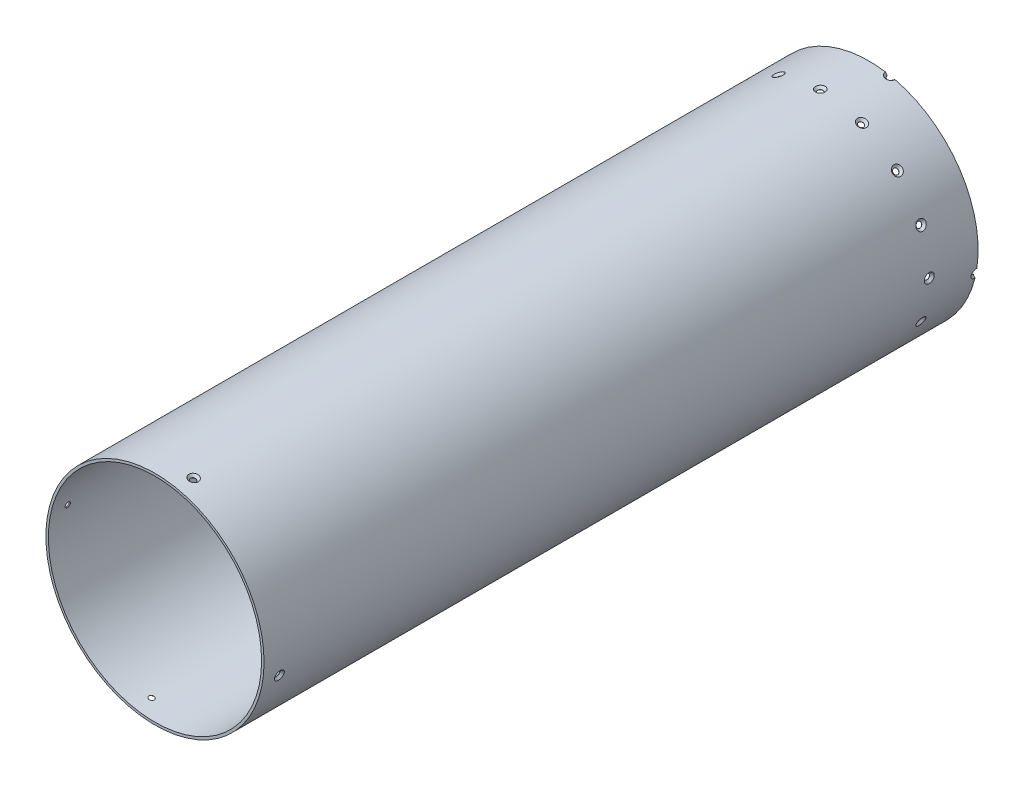
from build123d import *

# Parameters (mm, degrees)
SKETCH1_R                                       = 69.85
SKETCH1_R_2                                     = 68.2625
EXTRUDE1_DEPTH                                  = 457.2
CSK_FOR_M3_FLAT_HEAD_MACHINE_SCREW1_D           = 3.4
CSK_FOR_M3_FLAT_HEAD_MACHINE_SCREW1_CSINK_D     = 6.3
CSK_FOR_M3_FLAT_HEAD_MACHINE_SCREW1_CSINK_ANGLE = 90
CIRPATTERN1_COUNT                               = 16
F_10_CLEARANCE_HOLE1_D                          = 5.1054
F_10_CLEARANCE_HOLE1_DEPTH                      = 12.7
F_10_CLEARANCE_HOLE1_TIP                        = 1.533816902
CSK_FOR_M3_FLAT_HEAD_MACHINE_SCREW2_AT_2_COUNT  = 2
CSK_FOR_M3_FLAT_HEAD_MACHINE_SCREW2_AT_2_PITCH  = 446.0748
CIRPATTERN2_COUNT                               = 4


with BuildPart() as part:
    # Sketch1 → Extrude1 (new body)
    with BuildSketch(Plane.XY):
        Circle(SKETCH1_R)
        Circle(SKETCH1_R_2, mode=Mode.SUBTRACT)
    extrude(amount=EXTRUDE1_DEPTH)

    # CSK for M3 Flat Head Machine Screw1 (through all)
    with Locations(Plane(origin=(0, -69.85, 31.242), x_dir=(1, 0, 0), z_dir=(0, -1, 0))):
        with Locations((0, 0)):
            csk_for_m3_flat_head_machine_screw1 = CounterSinkHole(CSK_FOR_M3_FLAT_HEAD_MACHINE_SCREW1_D / 2, CSK_FOR_M3_FLAT_HEAD_MACHINE_SCREW1_CSINK_D / 2, counter_sink_angle=CSK_FOR_M3_FLAT_HEAD_MACHINE_SCREW1_CSINK_ANGLE)

    # CirPattern1: CSK for M3 Flat Head Machine Screw1 ×16 about axis
    cirpattern1_axis = Axis((0, 0, 457.2), (0, 0, -1))
    for i in range(1, CIRPATTERN1_COUNT):
        add(csk_for_m3_flat_head_machine_screw1.rotate(cirpattern1_axis, i * 360 / CIRPATTERN1_COUNT), mode=Mode.SUBTRACT)

    # #10 Clearance Hole1
    with Locations(Plane(origin=(13.627058993, -68.507851836, 31.242), x_dir=(0.9807852804032304, 0.19509032201612855, 0), z_dir=(0.19509032201612853, -0.9807852804032303, 0))):
        with Locations((0, 0)):
            Hole(F_10_CLEARANCE_HOLE1_D / 2, depth=F_10_CLEARANCE_HOLE1_DEPTH)
            with Locations((0, 0, -(F_10_CLEARANCE_HOLE1_DEPTH + F_10_CLEARANCE_HOLE1_TIP / 2))):  # 118° drill point
                Cone(0, F_10_CLEARANCE_HOLE1_D / 2, F_10_CLEARANCE_HOLE1_TIP, mode=Mode.SUBTRACT)

    # Sketch16 → CSK for M3 Flat Head Machine Screw2 (revolve, cut)
    with BuildSketch(Plane(origin=(13.627058993, 68.507851836, 0), x_dir=(-0.9807852804032304, 0.19509032201612872, 0), z_dir=(0, 0, 1))):
        Polygon((0, 0), (0, 8.641463052), (1.7, 7.62), (1.7, 1.45), (3.15, 0), align=None)
    csk_for_m3_flat_head_machine_screw2 = revolve(axis=Axis((14.865882538, 74.735838367, 0), (-0.19509032201612872, -0.9807852804032304, 0)), mode=Mode.SUBTRACT)

    # CSK for M3 Flat Head Machine Screw2 at 2: CSK for M3 Flat Head Machine Screw2 ×2
    with Locations(*[(0, 0, i * CSK_FOR_M3_FLAT_HEAD_MACHINE_SCREW2_AT_2_PITCH) for i in range(1, CSK_FOR_M3_FLAT_HEAD_MACHINE_SCREW2_AT_2_COUNT)]):
        add(csk_for_m3_flat_head_machine_screw2, mode=Mode.SUBTRACT)

    # CirPattern2: CSK for M3 Flat Head Machine Screw2 ×4 about axis
    cirpattern2_axis = Axis((0, 0, 457.2), (0, 0, -1))
    for i in range(1, CIRPATTERN2_COUNT):
        add(csk_for_m3_flat_head_machine_screw2.rotate(cirpattern2_axis, i * 360 / CIRPATTERN2_COUNT), mode=Mode.SUBTRACT)

    # CirPattern2 copy 1 sketch → CirPattern2 copy 1 (revolve, cut)
    with BuildSketch(Plane(origin=(68.507851836, -13.627058993, 446.0748), x_dir=(0.19509032201612866, 0.9807852804032304, 0), z_dir=(0, 0, 1))):
        Polygon((0, 0), (0, 8.641463052), (1.7, 7.62), (1.7, 1.45), (3.15, 0), align=None)
    revolve(axis=Axis((74.735838367, -14.865882538, 446.0748), (-0.9807852804032304, 0.19509032201612866, 0)), mode=Mode.SUBTRACT)

    # CirPattern2 copy 2 sketch → CirPattern2 copy 2 (revolve, cut)
    with BuildSketch(Plane(origin=(-13.627058993, -68.507851836, 446.0748), x_dir=(0.9807852804032304, -0.1950903220161286, 0), z_dir=(0, 0, 1))):
        Polygon((0, 0), (0, 8.641463052), (1.7, 7.62), (1.7, 1.45), (3.15, 0), align=None)
    revolve(axis=Axis((-14.865882538, -74.735838367, 446.0748), (0.1950903220161286, 0.9807852804032304, 0)), mode=Mode.SUBTRACT)

    # CirPattern2 copy 3 sketch → CirPattern2 copy 3 (revolve, cut)
    with BuildSketch(Plane(origin=(-68.507851836, 13.627058993, 446.0748), x_dir=(-0.19509032201612855, -0.9807852804032304, 0), z_dir=(0, 0, 1))):
        Polygon((0, 0), (0, 8.641463052), (1.7, 7.62), (1.7, 1.45), (3.15, 0), align=None)
    revolve(axis=Axis((-74.735838367, 14.865882538, 446.0748), (0.9807852804032304, -0.19509032201612855, 0)), mode=Mode.SUBTRACT)


solid = part.part
